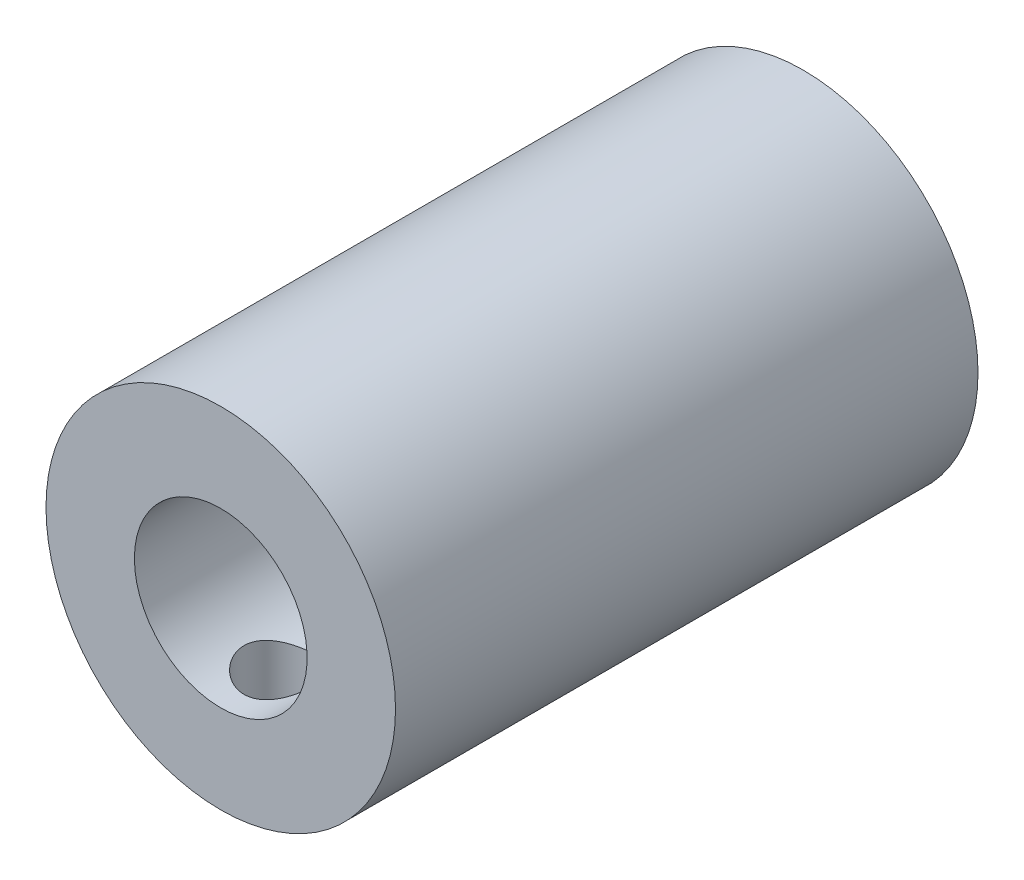
from build123d import *

# Parameters (mm, degrees)
ESBO_O1_R                 = 7.5
RESSALTO_EXTRUS_O1_DEPTH  = 25
ESBO_O2_R                 = 2.55
CORTE_EXTRUS_O1_DEPTH     = 5
CORTE_EXTRUS_O2_START     = 7
CORTE_EXTRUS_O2_OUTLINE_R = 3.706811579
CORTE_EXTRUS_O2_DEPTH     = 18
ESBO_O3_R                 = 1.5
CORTE_EXTRUS_O3_DEPTH     = 18


# Read off the part's stored shape, not the designer's step: Corte-extrusão2
with BuildPart() as part:
    # Esboço1 → Ressalto-extrusão1 (new body)
    with BuildSketch(Plane.XY):
        Circle(ESBO_O1_R)
    extrude(amount=RESSALTO_EXTRUS_O1_DEPTH)

    # Esboço2 → Corte-extrusão1 (cut)
    with BuildSketch(Plane.XY):
        Circle(ESBO_O2_R)
    extrude(amount=CORTE_EXTRUS_O1_DEPTH, mode=Mode.SUBTRACT)

    # Corte-extrusão2 outline → Corte-extrusão2 (cut)
    with BuildSketch(Plane.XY.offset(CORTE_EXTRUS_O2_START)):
        Circle(CORTE_EXTRUS_O2_OUTLINE_R)
    extrude(amount=CORTE_EXTRUS_O2_DEPTH, mode=Mode.SUBTRACT)

    # Esboço3 → Corte-extrusão3 (cut)
    with BuildSketch(Plane(origin=(0, 0, 0), x_dir=(1, 0, 0), z_dir=(0, 1, 0))):
        with Locations(Location((0, -2.967761403, 0), (0, 0, 270))):
            Circle(ESBO_O3_R)
        with Locations(Location((0, -22.5, 0), (0, 0, 270))):
            Circle(ESBO_O3_R)
    extrude(amount=-CORTE_EXTRUS_O3_DEPTH, mode=Mode.SUBTRACT)


solid = part.part
